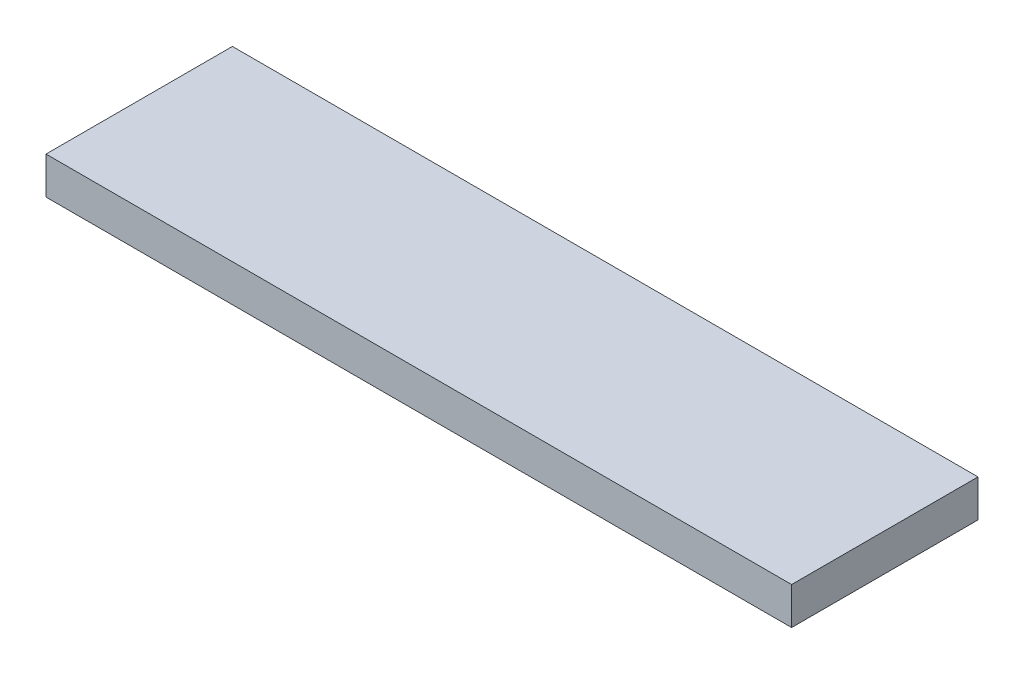
from build123d import *

# Parameters (mm, degrees)
SKETCH1_W           = 60
SKETCH1_H           = 3
BOSS_EXTRUDE1_DEPTH = 15


with BuildPart() as part:
    # Sketch1 → Boss-Extrude1 (new body)
    with BuildSketch(Plane.XY):
        with Locations((30, 1.5)):
            Rectangle(SKETCH1_W, SKETCH1_H)
    extrude(amount=BOSS_EXTRUDE1_DEPTH)


solid = part.part
